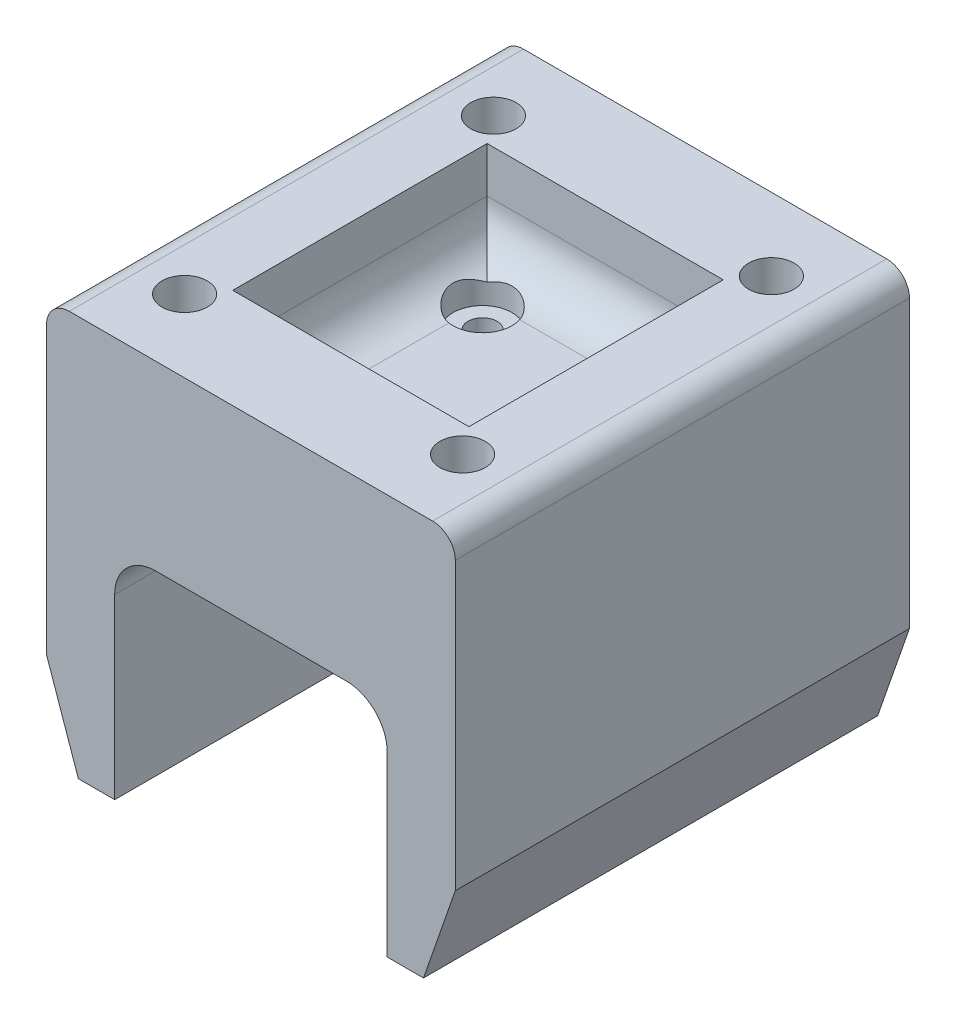
from build123d import *

# Parameters (mm, degrees)
SKETCH1_W                                            = 45
SKETCH1_H                                            = 50
SKETCH1_R                                            = 1.5
SKETCH1_R_2                                          = 2.5
BOSS_EXTRUDE1_DEPTH                                  = 20
SKETCH3_W                                            = 26
SKETCH3_H                                            = 28
CUT_EXTRUDE1_DEPTH                                   = 10
REFRENTADO_PARA_TORNILLO_CON_CABEZA_PLAN_D           = 3.2
REFRENTADO_PARA_TORNILLO_CON_CABEZA_PLAN_CBORE_D     = 6.5
REFRENTADO_PARA_TORNILLO_CON_CABEZA_PLAN_CBORE_DEPTH = 2
FILLET4_R                                            = 5
BOSS_EXTRUDE4_DEPTH                                  = 50
FILLET5_R                                            = 4.5
FILLET6_R                                            = 2.5


with BuildPart() as part:
    # Sketch1 → Boss-Extrude1 (new body)
    with BuildSketch(Plane(origin=(0, 0, 0), x_dir=(1, 0, 0), z_dir=(0, 1, 0))):
        Rectangle(SKETCH1_W, SKETCH1_H)
        with Locations(Location((-7.5, 8, 0), (0, 0, 270))):
            Circle(SKETCH1_R, mode=Mode.SUBTRACT)
        with Locations(Location((7.5, 8, 0), (0, 0, 270))):
            Circle(SKETCH1_R, mode=Mode.SUBTRACT)
        with Locations(Location((7.5, -8, 0), (0, 0, 270))):
            Circle(SKETCH1_R, mode=Mode.SUBTRACT)
        with Locations(Location((-7.5, -8, 0), (0, 0, 270))):
            Circle(SKETCH1_R, mode=Mode.SUBTRACT)
        with Locations(Location((15.3, 17, 0), (0, 0, 270))):
            Circle(SKETCH1_R_2, mode=Mode.SUBTRACT)
        with Locations(Location((-15.3, 17, 0), (0, 0, 270))):
            Circle(SKETCH1_R_2, mode=Mode.SUBTRACT)
        with Locations(Location((-15.3, -17, 0), (0, 0, 270))):
            Circle(SKETCH1_R_2, mode=Mode.SUBTRACT)
        with Locations(Location((15.3, -17, 0), (0, 0, 270))):
            Circle(SKETCH1_R_2, mode=Mode.SUBTRACT)
    extrude(amount=BOSS_EXTRUDE1_DEPTH)

    # Sketch3 → Cut-Extrude1 (cut)
    with BuildSketch(Plane(origin=(0, 20, 0), x_dir=(1, 0, 0), z_dir=(0, 1, 0))):
        Rectangle(SKETCH3_W, SKETCH3_H)
    extrude(amount=-CUT_EXTRUDE1_DEPTH, mode=Mode.SUBTRACT)

    # Refrentado para tornillo con cabeza plana de M32 (through all)
    with Locations(Plane(origin=(0, 10, 0), x_dir=(1, 0, 0), z_dir=(0, 1, 0))):
        with Locations((-7.5, 8), (-7.5, -8), (7.5, -8), (7.5, 8)):
            CounterBoreHole(REFRENTADO_PARA_TORNILLO_CON_CABEZA_PLAN_D / 2, REFRENTADO_PARA_TORNILLO_CON_CABEZA_PLAN_CBORE_D / 2, REFRENTADO_PARA_TORNILLO_CON_CABEZA_PLAN_CBORE_DEPTH)

    # Fillet4
    # the kernel refuses this fillet: 5 mm, written as the material it adds along each edge
    with BuildSketch(Plane(origin=(13, 10, 14), x_dir=(0, 1, 0), z_dir=(0, 0, -1))) as fillet4_piece_1_section:
        with BuildLine():
            CenterArc((FILLET4_R, -FILLET4_R), FILLET4_R, 90, 90)
            Line((0, -FILLET4_R), (0, 0))
            Line((0, 0), (FILLET4_R, 0))
        make_face()
    fillet4_piece_1 = extrude(amount=28, mode=Mode.PRIVATE)
    fillet4_piece_1 = fillet4_piece_1 - Plane(origin=(7.5, 11.149497573, 8), x_dir=(1, 0, 0), z_dir=(0, 1, 0)) * Cylinder(3.25, 76, mode=Mode.PRIVATE)
    fillet4_piece_1 = fillet4_piece_1 - Plane(origin=(7.5, 11.149497573, -8), x_dir=(1, 0, 0), z_dir=(0, 1, 0)) * Cylinder(3.25, 76, mode=Mode.PRIVATE)
    add(fillet4_piece_1)
    with BuildSketch(Plane(origin=(-13, 10, 14), x_dir=(0, 1, 0), z_dir=(1, 0, 0))) as fillet4_piece_2_section:
        with BuildLine():
            CenterArc((FILLET4_R, -FILLET4_R), FILLET4_R, 90, 90)
            Line((0, -FILLET4_R), (0, 0))
            Line((0, 0), (FILLET4_R, 0))
        make_face()
    fillet4_piece_2 = extrude(amount=26, mode=Mode.PRIVATE)
    fillet4_piece_2 = fillet4_piece_2 - Plane(origin=(-7.5, 11.135296279, 8), x_dir=(1, 0, 0), z_dir=(0, 1, 0)) * Cylinder(3.25, 72, mode=Mode.PRIVATE)
    fillet4_piece_2 = fillet4_piece_2 - Plane(origin=(7.5, 11.135296279, 8), x_dir=(1, 0, 0), z_dir=(0, 1, 0)) * Cylinder(3.25, 72, mode=Mode.PRIVATE)
    add(fillet4_piece_2)
    with BuildSketch(Plane(origin=(-13, 10, -14), x_dir=(0, 1, 0), z_dir=(0, 0, 1))) as fillet4_piece_3_section:
        with BuildLine():
            CenterArc((FILLET4_R, -FILLET4_R), FILLET4_R, 90, 90)
            Line((0, -FILLET4_R), (0, 0))
            Line((0, 0), (FILLET4_R, 0))
        make_face()
    fillet4_piece_3 = extrude(amount=28, mode=Mode.PRIVATE)
    fillet4_piece_3 = fillet4_piece_3 - Plane(origin=(-7.5, 11.149494803, 8), x_dir=(1, 0, 0), z_dir=(0, 1, 0)) * Cylinder(3.25, 76, mode=Mode.PRIVATE)
    fillet4_piece_3 = fillet4_piece_3 - Plane(origin=(-7.5, 11.149494803, -8), x_dir=(1, 0, 0), z_dir=(0, 1, 0)) * Cylinder(3.25, 76, mode=Mode.PRIVATE)
    add(fillet4_piece_3)
    with BuildSketch(Plane(origin=(13, 10, -14), x_dir=(0, 1, 0), z_dir=(-1, 0, 0))) as fillet4_piece_4_section:
        with BuildLine():
            CenterArc((FILLET4_R, -FILLET4_R), FILLET4_R, 90, 90)
            Line((0, -FILLET4_R), (0, 0))
            Line((0, 0), (FILLET4_R, 0))
        make_face()
    fillet4_piece_4 = extrude(amount=26, mode=Mode.PRIVATE)
    fillet4_piece_4 = fillet4_piece_4 - Plane(origin=(-7.5, 11.135296279, -8), x_dir=(1, 0, 0), z_dir=(0, 1, 0)) * Cylinder(3.25, 72, mode=Mode.PRIVATE)
    fillet4_piece_4 = fillet4_piece_4 - Plane(origin=(7.5, 11.135296279, -8), x_dir=(1, 0, 0), z_dir=(0, 1, 0)) * Cylinder(3.25, 72, mode=Mode.PRIVATE)
    add(fillet4_piece_4)

    # Sketch10 → Boss-Extrude4 (add, through all)
    with BuildSketch(Plane(origin=(0, 0, -25), x_dir=(-1, 0, 0), z_dir=(0, 0, -1))):
        Polygon((-15, 0), (-15, -24.067665252), (-19, -24.067665252), (-22.5, -14), (-22.5, 0), align=None)
    boss_extrude4 = extrude(amount=-BOSS_EXTRUDE4_DEPTH)

    # Mirror1: Boss-Extrude4 across plane
    add(boss_extrude4.mirror(Plane(origin=(0, 0, 0), x_dir=(0, 0, 1), z_dir=(1, 0, 0))))

    # Fillet5
    # the kernel refuses this fillet: 4.5 mm, written as the material it adds along each edge
    with BuildSketch(Plane(origin=(15, 0, -25.768065271), x_dir=(-1, 0, 0), z_dir=(0, 0, 1))) as fillet5_piece_1_section:
        with BuildLine():
            CenterArc((FILLET5_R, FILLET5_R), FILLET5_R, 180, 90)
            Line((0, FILLET5_R), (0, 0))
            Line((0, 0), (FILLET5_R, 0))
        make_face()
    fillet5_piece_1 = extrude(amount=51.536130542, mode=Mode.PRIVATE)
    fillet5_piece_1 = split(fillet5_piece_1, bisect_by=Plane(origin=(13.936107491, -0.973119841, 25), z_dir=(0, 0, -1)), keep=Keep.TOP, mode=Mode.PRIVATE)
    fillet5_piece_1 = fillet5_piece_1 - Plane(origin=(15.3, -0.973119841, 17), x_dir=(0, 0, 1), z_dir=(0, -1, 0)) * Cylinder(2.5, 122, mode=Mode.PRIVATE)
    fillet5_piece_1 = fillet5_piece_1 - Plane(origin=(15.3, -0.973119841, -17), x_dir=(0, 0, 1), z_dir=(0, -1, 0)) * Cylinder(2.5, 122, mode=Mode.PRIVATE)
    fillet5_piece_1 = split(fillet5_piece_1, bisect_by=Plane(origin=(13.936107491, -0.973119841, -25), z_dir=(0, 0, 1)), keep=Keep.TOP, mode=Mode.PRIVATE)
    add(fillet5_piece_1)
    with BuildSketch(Plane(origin=(-15, 0, -25.768065271), x_dir=(1, 0, 0), z_dir=(0, 0, 1))) as fillet5_piece_2_section:
        with BuildLine():
            CenterArc((FILLET5_R, -FILLET5_R), FILLET5_R, 90, 90)
            Line((0, -FILLET5_R), (0, 0))
            Line((0, 0), (FILLET5_R, 0))
        make_face()
    fillet5_piece_2 = extrude(amount=51.536130542, mode=Mode.PRIVATE)
    fillet5_piece_2 = fillet5_piece_2 - Plane(origin=(-15.3, -0.973119841, -17), x_dir=(0, 0, 1), z_dir=(0, -1, 0)) * Cylinder(2.5, 122, mode=Mode.PRIVATE)
    fillet5_piece_2 = fillet5_piece_2 - Plane(origin=(-15.3, -0.973119841, 17), x_dir=(0, 0, 1), z_dir=(0, -1, 0)) * Cylinder(2.5, 122, mode=Mode.PRIVATE)
    fillet5_piece_2 = split(fillet5_piece_2, bisect_by=Plane(origin=(-13.936107491, -0.973119841, 25), z_dir=(0, 0, -1)), keep=Keep.TOP, mode=Mode.PRIVATE)
    fillet5_piece_2 = split(fillet5_piece_2, bisect_by=Plane(origin=(-13.936107491, -0.973119841, -25), z_dir=(0, 0, 1)), keep=Keep.TOP, mode=Mode.PRIVATE)
    add(fillet5_piece_2)

    # Fillet6
    fillet6_edges = [part.edges().sort_by_distance(p)[0] for p in [
        (-22.5, 20, 0),
        (22.5, 20, 0),
    ]]
    fillet(fillet6_edges, radius=FILLET6_R)


solid = part.part
